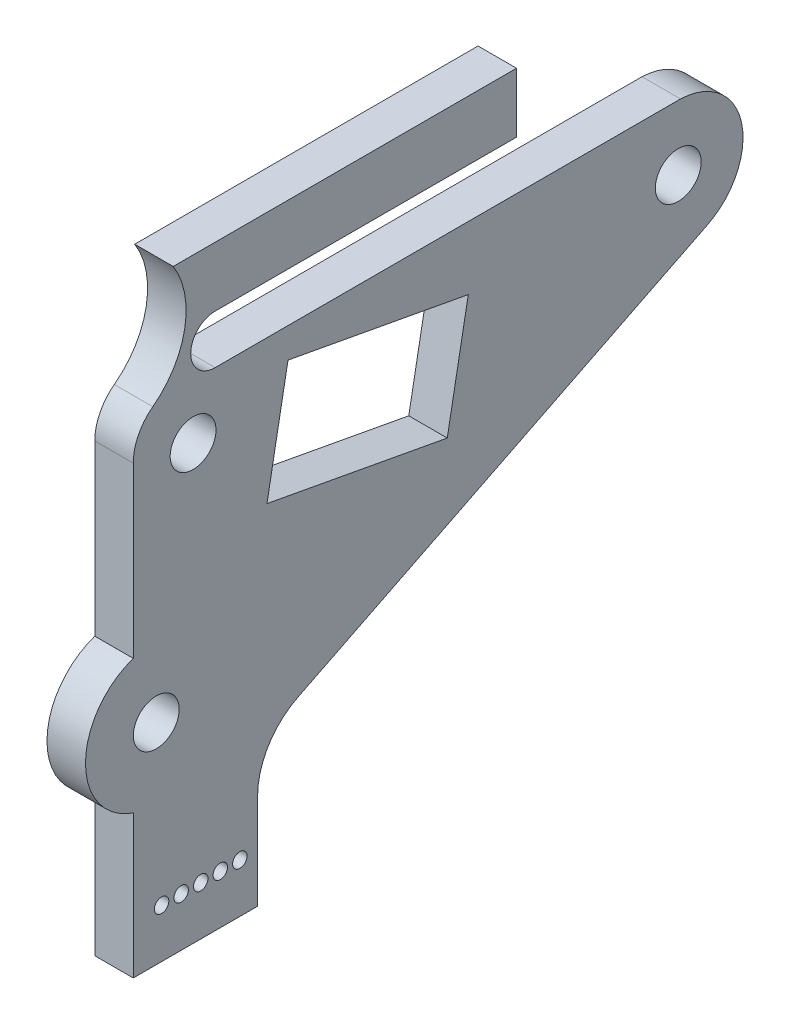
from build123d import *

# Parameters (mm, degrees)
SKETCH1_R           = 2.38125
SKETCH1_R_2         = 0.75
BOSS_EXTRUDE1_DEPTH = 2


with BuildPart() as part:
    # Sketch1 → Boss-Extrude1 (new, symmetric)
    with BuildSketch(Plane(origin=(0, 0, 0), x_dir=(0, 0, -1), z_dir=(1, 0, 0))):
        with BuildLine():
            Line((-56.625400227, 2.386991318), (-56.625400227, -15.182793561))
            ThreePointArc((-56.625400227, -15.182793561), (-61.589569936, -22.137211246), (-56.625400227, -29.091628931))
            Line((-56.625400227, -29.091628931), (-56.625400227, -43.943749635))
            Line((-56.625400227, -43.943749635), (-43.707520647, -43.943749635))
            Line((-43.707520647, -43.943749635), (-43.707520647, -34.030414011))
            ThreePointArc((-43.707520647, -34.030414011), (-42.567322793, -30.020854914), (-39.487950002, -27.21121463))
            Line((-39.487950002, -27.21121463), (-25.808814493, -20.390042329))
            Line((-25.808814493, -20.390042329), (3.003273, -6.022744555))
            ThreePointArc((3.003273, -6.022744555), (6.576528363, 1.429116992), (0.23290188, 6.72598375))
            Line((0.23290188, 6.72598375), (-48.116810183, 6.72598375))
            ThreePointArc((-48.116810183, 6.72598375), (-50.656810183, 9.26598375), (-48.116810183, 11.80598375))
            Line((-48.116810183, 11.80598375), (-16.803992093, 11.80598375))
            Line((-16.803992093, 11.80598375), (-16.803992093, 18.009025029))
            Line((-16.803992093, 18.009025029), (-52.475776529, 18.009025029))
            ThreePointArc((-52.475776529, 18.009025029), (-51.277962728, 11.814262359), (-54.597011148, 6.44828062))
            ThreePointArc((-54.597011148, 6.44828062), (-56.090099528, 4.65681692), (-56.625400227, 2.386991318))
        make_face()
        Circle(SKETCH1_R, mode=Mode.SUBTRACT)
        with Locations((-45.553086475, -38.863749635)):
            Circle(SKETCH1_R_2, mode=Mode.SUBTRACT)
        with Locations((-47.585086475, -38.863749635)):
            Circle(SKETCH1_R_2, mode=Mode.SUBTRACT)
        with Locations((-49.617086475, -38.863749635)):
            Circle(SKETCH1_R_2, mode=Mode.SUBTRACT)
        with Locations((-51.649086475, -38.863749635)):
            Circle(SKETCH1_R_2, mode=Mode.SUBTRACT)
        with Locations((-54.236184525, -22.137211246)):
            Circle(SKETCH1_R, mode=Mode.SUBTRACT)
        with Locations((-50.410128911, 1.079375692)):
            Circle(SKETCH1_R, mode=Mode.SUBTRACT)
        with Locations((-53.681086475, -38.863749635)):
            Circle(SKETCH1_R_2, mode=Mode.SUBTRACT)
        Polygon((-40.547855017, 3.612408172), (-21.81561352, 0.147494252), (-24.001169646, -11.668200482), (-42.733411143, -8.203286562), align=None, mode=Mode.SUBTRACT)
    extrude(amount=BOSS_EXTRUDE1_DEPTH, both=True)


solid = part.part
